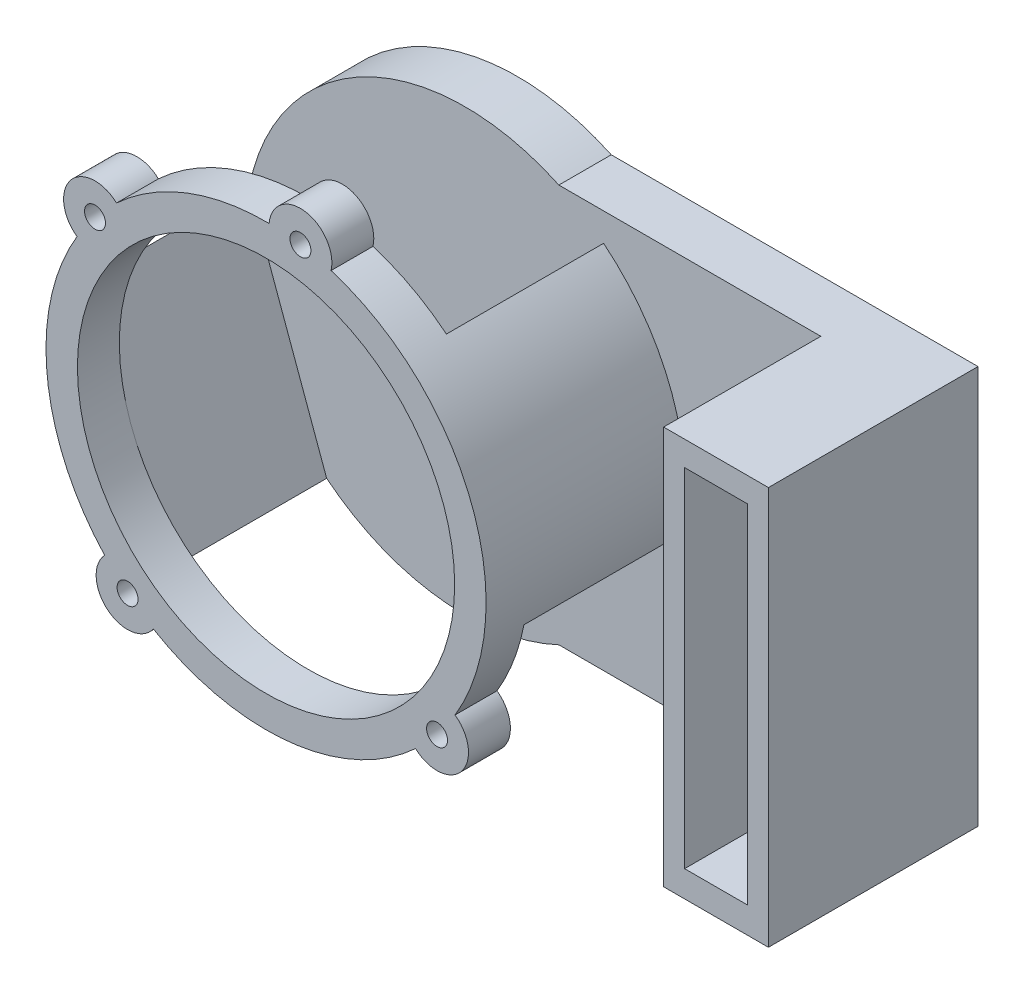
from build123d import *

# Parameters (mm, degrees)
ESTRUSIONE_ESTRUSIONE1_DEPTH = 2.5
SCHIZZO2_W                   = 10
SCHIZZO2_H                   = 38
ESTRUSIONE_ESTRUSIONE2_DEPTH = 15
SCHIZZO3_W                   = 6
SCHIZZO3_H                   = 33.15
TAGLIO_ESTRUSIONE1_DEPTH     = 13
ESTRUSIONE_SOTTILE1_START    = 19
SCHIZZO5_R                   = 21
SCHIZZO5_R_2                 = 18
ESTRUSIONE_SOTTILE1_DEPTH    = 19
SCHIZZO8_W                   = 36
SCHIZZO8_H                   = 15
TAGLIO_ESTRUSIONE2_DEPTH     = 70.157520353
SCHIZZO10_R                  = 3
ESTRUSIONE_ESTRUSIONE3_DEPTH = 4
FORO_PER_VITE_M1_6_1_D       = 2
FORO_PER_VITE_M1_6_1_DEPTH   = 3
FORO_PER_VITE_M1_6_1_TIP     = 0.600860619
SCHIZZO12_R                  = 1
TAGLIO_ESTRUSIONE3_DEPTH     = 3


with BuildPart() as part:
    # Schizzo1 → Estrusione-Estrusione1 (new, symmetric)
    with BuildSketch(Plane.XY):
        with BuildLine():
            Line((12.36549987, -26.390648792), (47.36549987, -26.390648792))
            Line((47.36549987, -26.390648792), (47.36549987, 11.609351208))
            Line((47.36549987, 11.609351208), (12.36549987, 11.609351208))
            ThreePointArc((12.36549987, 11.609351208), (-17.57877204, -7.390648792), (12.36549987, -26.390648792))
        make_face()
    extrude(amount=ESTRUSIONE_ESTRUSIONE1_DEPTH, both=True)

    # Schizzo2 → Estrusione-Estrusione2 (add)
    with BuildSketch(Plane.XY.offset(2.5)):
        with Locations((42.36549987, -7.390648792)):
            Rectangle(SCHIZZO2_W, SCHIZZO2_H)
    extrude(amount=ESTRUSIONE_ESTRUSIONE2_DEPTH)

    # Schizzo3 → Taglio-Estrusione1 (cut)
    with BuildSketch(Plane.XY.offset(17.5)):
        with Locations((42.36549987, -7.315648792)):
            Rectangle(SCHIZZO3_W, SCHIZZO3_H)
    extrude(amount=-TAGLIO_ESTRUSIONE1_DEPTH, mode=Mode.SUBTRACT)

    # Schizzo5 → Estrusione-Sottile1 (add)
    with BuildSketch(Plane.XY.offset(2.5).offset(ESTRUSIONE_SOTTILE1_START)):
        with Locations((3.42122796, -7.390648792)):
            Circle(SCHIZZO5_R)
        with Locations((3.42122796, -7.390648792)):
            Circle(SCHIZZO5_R_2, mode=Mode.SUBTRACT)
    extrude(amount=-ESTRUSIONE_SOTTILE1_DEPTH)

    # Schizzo8 → Taglio-Estrusione2 (cut, through all)
    with BuildSketch(Plane(origin=(-4.406906628, 12.10787645, 0), x_dir=(0.9396926207859102, 0.3420201433256638, 0), z_dir=(-0.3420201433256638, 0.9396926207859102, 0))):
        with Locations((0.687151909, -10)):
            Rectangle(SCHIZZO8_W, SCHIZZO8_H)
    extrude(amount=-TAGLIO_ESTRUSIONE2_DEPTH, mode=Mode.SUBTRACT)

    # Schizzo10 → Estrusione-Estrusione3 (add)
    with BuildSketch(Plane.XY.offset(21.5)):
        with Locations((-12.899464402, 5.82430489)):
            Circle(SCHIZZO10_R)
        with Locations((19.741920322, -20.605602474)):
            Circle(SCHIZZO10_R)
        with Locations((-9.793725722, -23.711341154)):
            Circle(SCHIZZO10_R)
        with Locations((6.705367377, 13.350962242)):
            Circle(SCHIZZO10_R)
    extrude(amount=-ESTRUSIONE_ESTRUSIONE3_DEPTH)

    # Foro per Vite M1.6-1
    with Locations(Plane(origin=(6.705367377, 13.350962242, 21.5), x_dir=(1, 0, 0), z_dir=(0, 0, 1))):
        with Locations((0, 0), (-19.604831779, -7.526657352), (-16.499093099, -37.062303396), (13.036552945, -33.956564716)):
            Hole(FORO_PER_VITE_M1_6_1_D / 2, depth=FORO_PER_VITE_M1_6_1_DEPTH)
            with Locations((0, 0, -(FORO_PER_VITE_M1_6_1_DEPTH + FORO_PER_VITE_M1_6_1_TIP / 2))):  # 118° drill point
                Cone(0, FORO_PER_VITE_M1_6_1_D / 2, FORO_PER_VITE_M1_6_1_TIP, mode=Mode.SUBTRACT)

    # Schizzo12 → Taglio-Estrusione3 (cut)
    with BuildSketch(Plane.XY.offset(2.5)):
        with Locations((3.42122796, -7.390648792)):
            Circle(SCHIZZO12_R)
    extrude(amount=-TAGLIO_ESTRUSIONE3_DEPTH, mode=Mode.SUBTRACT)


solid = part.part
